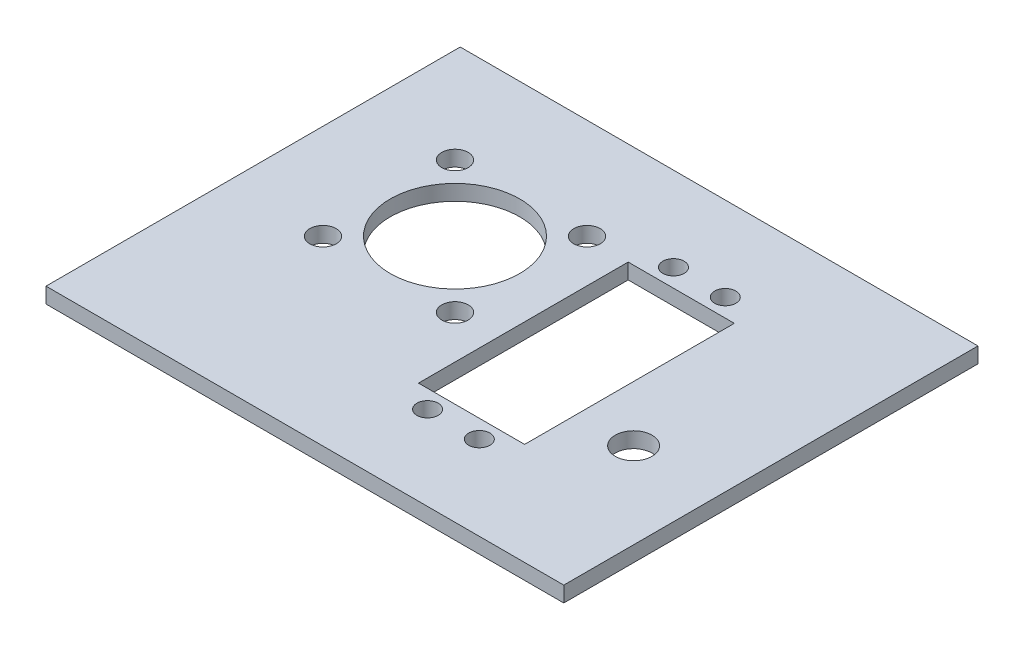
from build123d import *

# Parameters (mm, degrees)
SZKIC1_W                    = 100
SZKIC1_H                    = 80
SZKIC1_R                    = 2.55
SZKIC1_R_2                  = 2.05
SZKIC1_R_3                  = 3.55
SZKIC1_R_4                  = 12.5
SZKIC1_W_2                  = 20.5
SZKIC1_H_2                  = 40.5
DODANIE_WYCI_GNI_CIE1_DEPTH = 3


with BuildPart() as part:
    # Szkic1 → Dodanie-wyciągnięcie1 (new body)
    with BuildSketch(Plane(origin=(0, 0, 0), x_dir=(1, 0, 0), z_dir=(0, 1, 0))):
        with Locations((11.336719097, -8.838965942)):
            Rectangle(SZKIC1_W, SZKIC1_H)
        with Locations((-20.268770099, -13.743104788)):
            Circle(SZKIC1_R, mode=Mode.SUBTRACT)
        with Locations((5.231229901, -13.743104788)):
            Circle(SZKIC1_R, mode=Mode.SUBTRACT)
        with Locations((18.775116298, -32.588965942)):
            Circle(SZKIC1_R_2, mode=Mode.SUBTRACT)
        with Locations((28.775116298, -32.588965942)):
            Circle(SZKIC1_R_2, mode=Mode.SUBTRACT)
        with Locations((44.775116298, -18.788965942)):
            Circle(SZKIC1_R_3, mode=Mode.SUBTRACT)
        with Locations((-7.518770099, -0.993104788)):
            Circle(SZKIC1_R_4, mode=Mode.SUBTRACT)
        with Locations((-20.268770099, 11.756895212)):
            Circle(SZKIC1_R, mode=Mode.SUBTRACT)
        with Locations((5.231229901, 11.756895212)):
            Circle(SZKIC1_R, mode=Mode.SUBTRACT)
        with Locations((23.775116298, -8.838965942)):
            Rectangle(SZKIC1_W_2, SZKIC1_H_2, mode=Mode.SUBTRACT)
        with Locations((18.775116298, 14.911034058)):
            Circle(SZKIC1_R_2, mode=Mode.SUBTRACT)
        with Locations((28.775116298, 14.911034058)):
            Circle(SZKIC1_R_2, mode=Mode.SUBTRACT)
    extrude(amount=DODANIE_WYCI_GNI_CIE1_DEPTH)


solid = part.part
